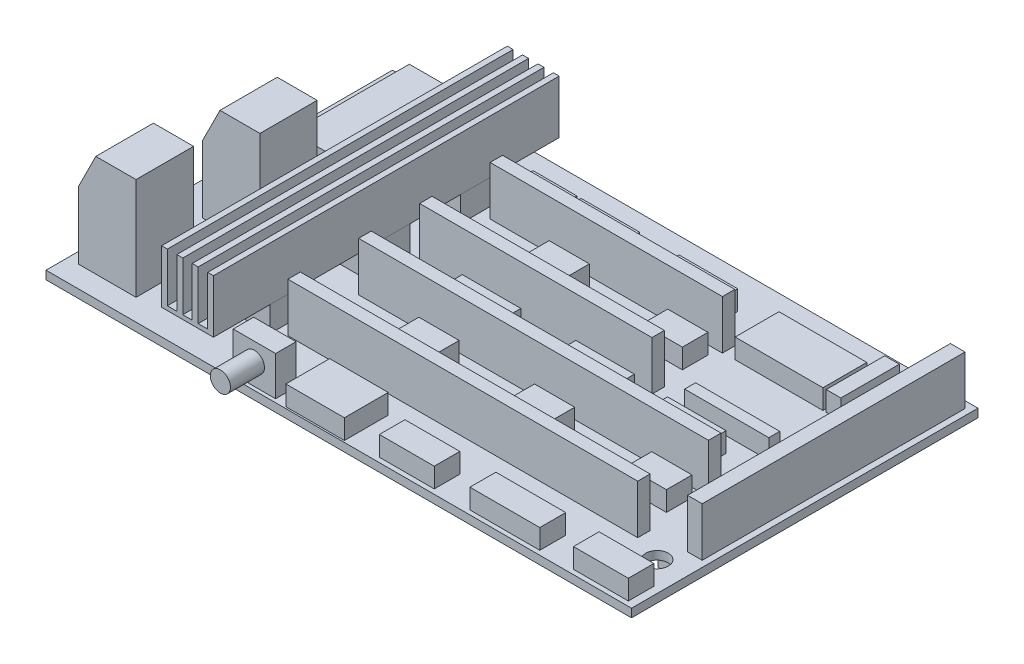
from build123d import *

# Parameters (mm, degrees)
SKETCH2_W              = 101.6076
SKETCH2_H              = 60.13
SKETCH2_R              = 1.95
BOSS_EXTRUDE1_DEPTH    = 1.45
SKETCH3_W              = 60.7104
SKETCH3_H              = 2.1564
BOSS_EXTRUDE2_DEPTH    = 8.5
SKETCH3_H_2            = 2.182
BOSS_EXTRUDE2_2_DEPTH  = 8.5
SKETCH3_W_2            = 40.3116
SKETCH3_H_3            = 2.1566
BOSS_EXTRUDE2_3_DEPTH  = 8.5
BOSS_EXTRUDE2_4_DEPTH  = 8.5
SKETCH3_W_3            = 2.5402
SKETCH3_H_4            = 45.6214
BOSS_EXTRUDE2_5_DEPTH  = 8.5
SKETCH4_W              = 10.1606
SKETCH4_H              = 7.6114
BOSS_EXTRUDE3_DEPTH    = 3.42
SKETCH4_W_2            = 9.5256
SKETCH4_H_2            = 4.4398
BOSS_EXTRUDE3_2_DEPTH  = 3.42
SKETCH4_W_3            = 12.1294
SKETCH4_H_3            = 4.5034
BOSS_EXTRUDE3_3_DEPTH  = 3.42
SKETCH4_W_4            = 9.5258
BOSS_EXTRUDE3_4_DEPTH  = 3.42
SKETCH4_W_5            = 6.9856
SKETCH4_H_4            = 4.44
BOSS_EXTRUDE3_5_DEPTH  = 3.42
SKETCH4_W_6            = 6.9854
BOSS_EXTRUDE3_6_DEPTH  = 3.42
BOSS_EXTRUDE3_7_DEPTH  = 3.42
BOSS_EXTRUDE3_8_DEPTH  = 3.42
BOSS_EXTRUDE3_9_DEPTH  = 3.42
SKETCH4_H_5            = 2.537
BOSS_EXTRUDE3_10_DEPTH = 3.42
SKETCH4_H_6            = 2.5372
BOSS_EXTRUDE3_11_DEPTH = 3.42
SKETCH4_H_7            = 5.0742
BOSS_EXTRUDE3_12_DEPTH = 3.42
SKETCH4_W_7            = 14.606
SKETCH4_H_8            = 1.9028
BOSS_EXTRUDE3_13_DEPTH = 3.42
SKETCH4_W_8            = 7.6204
BOSS_EXTRUDE3_14_DEPTH = 3.42
SKETCH4_W_9            = 10.1608
BOSS_EXTRUDE3_15_DEPTH = 3.42
BOSS_EXTRUDE3_16_DEPTH = 3.42
SKETCH4_W_10           = 15.241
BOSS_EXTRUDE3_17_DEPTH = 3.42
SKETCH4_W_11           = 2.5402
SKETCH4_H_9            = 10.1484
BOSS_EXTRUDE3_18_DEPTH = 3.42
SKETCH5_W              = 15.231
SKETCH5_H              = 2.5524
BOSS_EXTRUDE4_DEPTH    = 3.42
SKETCH5_W_2            = 20.3214
SKETCH5_H_2            = 2.5372
BOSS_EXTRUDE4_2_DEPTH  = 3.42
BOSS_EXTRUDE4_3_DEPTH  = 3.42
SKETCH5_W_3            = 5.0803
SKETCH5_H_3            = 45.6467
BOSS_EXTRUDE4_4_DEPTH  = 3.42
SKETCH5_W_4            = 20.3216
BOSS_EXTRUDE4_5_DEPTH  = 3.42
BOSS_EXTRUDE4_6_DEPTH  = 3.42
BOSS_EXTRUDE4_7_DEPTH  = 3.42
SKETCH6_W              = 8.381407694
SKETCH6_H              = 7.728310991
BOSS_EXTRUDE5_DEPTH    = 4.45
SKETCH6_H_2            = 7.72831099
BOSS_EXTRUDE5_2_DEPTH  = 4.45
BOSS_EXTRUDE5_3_DEPTH  = 4.45
SKETCH8_W              = 9
SKETCH8_H              = 60
BOSS_EXTRUDE6_DEPTH    = 9.25
SKETCH10_W             = 1.64
SKETCH10_H             = 8.522033602
CUT_EXTRUDE1_DEPTH     = 81.29992513
SKETCH11_W             = 7.8491
SKETCH11_H             = 20.3761
BOSS_EXTRUDE7_DEPTH    = 9.25
CHAMFER2_START         = -24
CHAMFER2_DEPTH         = 22
SKETCH12_W             = 9.9338
SKETCH12_H             = 9.938
BOSS_EXTRUDE8_DEPTH    = 17.7
SKETCH12_W_2           = 9.975
SKETCH12_H_2           = 9.9886
BOSS_EXTRUDE8_2_DEPTH  = 17.7
CHAMFER3_SIZE          = 6
CHAMFER3_SIZE2         = 3
CHAMFER4_SIZE          = 6
CHAMFER4_SIZE2         = 3
SKETCH13_W             = 7.3664
SKETCH13_H             = 3.552
BOSS_EXTRUDE9_DEPTH    = 6.8
SKETCH14_R             = 1.75
BOSS_EXTRUDE10_DEPTH   = 5.9


with BuildPart() as part:
    # Sketch2 → Boss-Extrude1 (new body)
    with BuildSketch(Plane(origin=(0, 0, 0), x_dir=(1, 0, 0), z_dir=(0, 1, 0))):
        with Locations((0.215202105, 0.322803158)):
            Rectangle(SKETCH2_W, SKETCH2_H)
        with Locations(Location((-35.347497895, 27.850703158, 0), (0, 0, 270))):
            Circle(SKETCH2_R, mode=Mode.SUBTRACT)
        with Locations(Location((45.938602105, -20.227996842, 0), (0, 0, 270))):
            Circle(SKETCH2_R, mode=Mode.SUBTRACT)
    extrude(amount=BOSS_EXTRUDE1_DEPTH)

    # Sketch11 → Boss-Extrude7 (add)
    with BuildSketch(Plane(origin=(0, 1.45, 0), x_dir=(1, 0, 0), z_dir=(0, 1, 0))):
        with Locations((-37.849447895, 13.303853158)):
            Rectangle(SKETCH11_W, SKETCH11_H)
    extrude(amount=BOSS_EXTRUDE7_DEPTH)

    # Chamfer2: read off the stored shape, not the designer's step
    # Chamfer2 outline → Chamfer2 (cut)
    with BuildSketch(Plane.XY.offset(CHAMFER2_START)):
        Polygon((-41.773997895, 7.7), (-40.773997895, 10.7), (-41.773997895, 10.7), align=None)
        Polygon((-34.924897895, 10.7), (-33.924897895, 7.7), (-33.924897895, 10.7), align=None)
    extrude(amount=CHAMFER2_DEPTH, mode=Mode.SUBTRACT)


with BuildPart() as body_2:
    # Sketch3 → Boss-Extrude2 (new body)
    with BuildSketch(Plane(origin=(0, 1.45, 0), x_dir=(1, 0, 0), z_dir=(0, 1, 0))):
        with Locations((10.606802105, -17.526896842)):
            Rectangle(SKETCH3_W, SKETCH3_H)
    extrude(amount=BOSS_EXTRUDE2_DEPTH)


with BuildPart() as body_3:
    # Sketch3 → Boss-Extrude2 2 (new body)
    with BuildSketch(Plane(origin=(0, 1.45, 0), x_dir=(1, 0, 0), z_dir=(0, 1, 0))):
        with Locations((10.606902105, -5.234496842)):
            Rectangle(SKETCH3_W, SKETCH3_H_2)
    extrude(amount=BOSS_EXTRUDE2_2_DEPTH)


with BuildPart() as body_4:
    # Sketch3 → Boss-Extrude2 3 (new body)
    with BuildSketch(Plane(origin=(0, 1.45, 0), x_dir=(1, 0, 0), z_dir=(0, 1, 0))):
        with Locations((0.459302105, 5.281903158)):
            Rectangle(SKETCH3_W_2, SKETCH3_H_3)
    extrude(amount=BOSS_EXTRUDE2_3_DEPTH)


with BuildPart() as body_5:
    # Sketch3 → Boss-Extrude2 4 (new body)
    with BuildSketch(Plane(origin=(0, 1.45, 0), x_dir=(1, 0, 0), z_dir=(0, 1, 0))):
        with Locations((0.407402105, 17.561603158)):
            Rectangle(SKETCH3_W_2, SKETCH3_H_3)
    extrude(amount=BOSS_EXTRUDE2_4_DEPTH)


with BuildPart() as body_6:
    # Sketch3 → Boss-Extrude2 5 (new body)
    with BuildSketch(Plane(origin=(0, 1.45, 0), x_dir=(1, 0, 0), z_dir=(0, 1, 0))):
        with Locations((48.682002105, 6.401203158)):
            Rectangle(SKETCH3_W_3, SKETCH3_H_4)
    extrude(amount=BOSS_EXTRUDE2_5_DEPTH)


with BuildPart() as body_7:
    # Sketch4 → Boss-Extrude3 (new body)
    with BuildSketch(Plane(origin=(0, 1.45, 0), x_dir=(1, 0, 0), z_dir=(0, 1, 0))):
        with Locations((-4.179297895, -25.644696842)):
            Rectangle(SKETCH4_W, SKETCH4_H)
    extrude(amount=BOSS_EXTRUDE3_DEPTH)


with BuildPart() as body_8:
    # Sketch4 → Boss-Extrude3 2 (new body)
    with BuildSketch(Plane(origin=(0, 1.45, 0), x_dir=(1, 0, 0), z_dir=(0, 1, 0))):
        with Locations((11.214302105, -26.710196842)):
            Rectangle(SKETCH4_W_2, SKETCH4_H_2)
    extrude(amount=BOSS_EXTRUDE3_2_DEPTH)


with BuildPart() as body_9:
    # Sketch4 → Boss-Extrude3 3 (new body)
    with BuildSketch(Plane(origin=(0, 1.45, 0), x_dir=(1, 0, 0), z_dir=(0, 1, 0))):
        with Locations((28.290602105, -26.741996842)):
            Rectangle(SKETCH4_W_3, SKETCH4_H_3)
    extrude(amount=BOSS_EXTRUDE3_3_DEPTH)


with BuildPart() as body_10:
    # Sketch4 → Boss-Extrude3 4 (new body)
    with BuildSketch(Plane(origin=(0, 1.45, 0), x_dir=(1, 0, 0), z_dir=(0, 1, 0))):
        with Locations((44.897102105, -26.710196842)):
            Rectangle(SKETCH4_W_4, SKETCH4_H_2)
    extrude(amount=BOSS_EXTRUDE3_4_DEPTH)


with BuildPart() as body_11:
    # Sketch4 → Boss-Extrude3 5 (new body)
    with BuildSketch(Plane(origin=(0, 1.45, 0), x_dir=(1, 0, 0), z_dir=(0, 1, 0))):
        with Locations((36.158802105, -10.097096842)):
            Rectangle(SKETCH4_W_5, SKETCH4_H_4)
    extrude(amount=BOSS_EXTRUDE3_5_DEPTH)


with BuildPart() as body_12:
    # Sketch4 → Boss-Extrude3 6 (new body)
    with BuildSketch(Plane(origin=(0, 1.45, 0), x_dir=(1, 0, 0), z_dir=(0, 1, 0))):
        with Locations((15.811902105, -10.097096842)):
            Rectangle(SKETCH4_W_6, SKETCH4_H_4)
    extrude(amount=BOSS_EXTRUDE3_6_DEPTH)


with BuildPart() as body_13:
    # Sketch4 → Boss-Extrude3 7 (new body)
    with BuildSketch(Plane(origin=(0, 1.45, 0), x_dir=(1, 0, 0), z_dir=(0, 1, 0))):
        with Locations((-4.255497895, -10.097096842)):
            Rectangle(SKETCH4_W_5, SKETCH4_H_4)
    extrude(amount=BOSS_EXTRUDE3_7_DEPTH)


with BuildPart() as body_14:
    # Sketch4 → Boss-Extrude3 8 (new body)
    with BuildSketch(Plane(origin=(0, 1.45, 0), x_dir=(1, 0, 0), z_dir=(0, 1, 0))):
        with Locations((-4.458697895, 12.711603158)):
            Rectangle(SKETCH4_W_5, SKETCH4_H_4)
    extrude(amount=BOSS_EXTRUDE3_8_DEPTH)


with BuildPart() as body_15:
    # Sketch4 → Boss-Extrude3 9 (new body)
    with BuildSketch(Plane(origin=(0, 1.45, 0), x_dir=(1, 0, 0), z_dir=(0, 1, 0))):
        with Locations((16.116702105, 12.711603158)):
            Rectangle(SKETCH4_W_6, SKETCH4_H_4)
    extrude(amount=BOSS_EXTRUDE3_9_DEPTH)


with BuildPart() as body_16:
    # Sketch4 → Boss-Extrude3 10 (new body)
    with BuildSketch(Plane(origin=(0, 1.45, 0), x_dir=(1, 0, 0), z_dir=(0, 1, 0))):
        with Locations((-5.296997895, 1.020503158)):
            Rectangle(SKETCH4_W, SKETCH4_H_5)
    extrude(amount=BOSS_EXTRUDE3_10_DEPTH)


with BuildPart() as body_17:
    # Sketch4 → Boss-Extrude3 11 (new body)
    with BuildSketch(Plane(origin=(0, 1.45, 0), x_dir=(1, 0, 0), z_dir=(0, 1, 0))):
        with Locations((14.440202105, 0.995203158)):
            Rectangle(SKETCH4_W, SKETCH4_H_6)
    extrude(amount=BOSS_EXTRUDE3_11_DEPTH)


with BuildPart() as body_18:
    # Sketch4 → Boss-Extrude3 12 (new body)
    with BuildSketch(Plane(origin=(0, 1.45, 0), x_dir=(1, 0, 0), z_dir=(0, 1, 0))):
        with Locations((30.875302105, -0.806196842)):
            Rectangle(SKETCH4_W, SKETCH4_H_7)
    extrude(amount=BOSS_EXTRUDE3_12_DEPTH)


with BuildPart() as body_19:
    # Sketch4 → Boss-Extrude3 13 (new body)
    with BuildSketch(Plane(origin=(0, 1.45, 0), x_dir=(1, 0, 0), z_dir=(0, 1, 0))):
        with Locations((33.415402105, 5.333703158)):
            Rectangle(SKETCH4_W_7, SKETCH4_H_8)
    extrude(amount=BOSS_EXTRUDE3_13_DEPTH)


with BuildPart() as body_20:
    # Sketch4 → Boss-Extrude3 14 (new body)
    with BuildSketch(Plane(origin=(0, 1.45, 0), x_dir=(1, 0, 0), z_dir=(0, 1, 0))):
        with Locations((-16.054797895, 22.789103158)):
            Rectangle(SKETCH4_W_8, SKETCH4_H_6)
    extrude(amount=BOSS_EXTRUDE3_14_DEPTH)


with BuildPart() as body_21:
    # Sketch4 → Boss-Extrude3 15 (new body)
    with BuildSketch(Plane(origin=(0, 1.45, 0), x_dir=(1, 0, 0), z_dir=(0, 1, 0))):
        with Locations((-6.440097895, 22.789103158)):
            Rectangle(SKETCH4_W_9, SKETCH4_H_6)
    extrude(amount=BOSS_EXTRUDE3_15_DEPTH)


with BuildPart() as body_22:
    # Sketch4 → Boss-Extrude3 16 (new body)
    with BuildSketch(Plane(origin=(0, 1.45, 0), x_dir=(1, 0, 0), z_dir=(0, 1, 0))):
        with Locations((10.553702105, 22.789103158)):
            Rectangle(SKETCH4_W, SKETCH4_H_6)
    extrude(amount=BOSS_EXTRUDE3_16_DEPTH)


with BuildPart() as body_23:
    # Sketch4 → Boss-Extrude3 17 (new body)
    with BuildSketch(Plane(origin=(0, 1.45, 0), x_dir=(1, 0, 0), z_dir=(0, 1, 0))):
        with Locations((30.291002105, 20.391603158)):
            Rectangle(SKETCH4_W_10, SKETCH4_H)
    extrude(amount=BOSS_EXTRUDE3_17_DEPTH)


with BuildPart() as body_24:
    # Sketch4 → Boss-Extrude3 18 (new body)
    with BuildSketch(Plane(origin=(0, 1.45, 0), x_dir=(1, 0, 0), z_dir=(0, 1, 0))):
        with Locations((39.740502105, 21.672803158)):
            Rectangle(SKETCH4_W_11, SKETCH4_H_9)
    extrude(amount=BOSS_EXTRUDE3_18_DEPTH)


with BuildPart() as body_25:
    # Sketch5 → Boss-Extrude4 (new body)
    with BuildSketch(Plane.XZ):
        with Locations((-11.004797895, 20.278696842)):
            Rectangle(SKETCH5_W, SKETCH5_H)
    extrude(amount=BOSS_EXTRUDE4_DEPTH)


with BuildPart() as body_26:
    # Sketch5 → Boss-Extrude4 2 (new body)
    with BuildSketch(Plane.XZ):
        with Locations((9.283702105, 20.265996842)):
            Rectangle(SKETCH5_W_2, SKETCH5_H_2)
    extrude(amount=BOSS_EXTRUDE4_2_DEPTH)


with BuildPart() as body_27:
    # Sketch5 → Boss-Extrude4 3 (new body)
    with BuildSketch(Plane.XZ):
        with Locations((32.145402105, 20.265996842)):
            Rectangle(SKETCH5_W_2, SKETCH5_H_2)
    extrude(amount=BOSS_EXTRUDE4_3_DEPTH)


with BuildPart() as body_28:
    # Sketch5 → Boss-Extrude4 4 (new body)
    with BuildSketch(Plane.XZ):
        with Locations((44.871752105, -6.388553158)):
            Rectangle(SKETCH5_W_3, SKETCH5_H_3)
    extrude(amount=BOSS_EXTRUDE4_4_DEPTH)


with BuildPart() as body_29:
    # Sketch5 → Boss-Extrude4 5 (new body)
    with BuildSketch(Plane.XZ):
        with Locations((-17.616897895, -27.939503158)):
            Rectangle(SKETCH5_W_4, SKETCH5_H_2)
    extrude(amount=BOSS_EXTRUDE4_5_DEPTH)


with BuildPart() as body_30:
    # Sketch5 → Boss-Extrude4 6 (new body)
    with BuildSketch(Plane.XZ):
        with Locations((4.228702105, -27.939503158)):
            Rectangle(SKETCH5_W_4, SKETCH5_H_2)
    extrude(amount=BOSS_EXTRUDE4_6_DEPTH)


with BuildPart() as body_31:
    # Sketch5 → Boss-Extrude4 7 (new body)
    with BuildSketch(Plane.XZ):
        with Locations((27.090302105, -27.939503158)):
            Rectangle(SKETCH5_W_2, SKETCH5_H_2)
    extrude(amount=BOSS_EXTRUDE4_7_DEPTH)


with BuildPart() as body_32:
    # Sketch6 → Boss-Extrude5 (new body)
    with BuildSketch(Plane(origin=(0, 1.45, 0), x_dir=(1, 0, 0), z_dir=(0, 1, 0))):
        with Locations((-25.799816581, 17.085618546)):
            Rectangle(SKETCH6_W, SKETCH6_H)
    extrude(amount=BOSS_EXTRUDE5_DEPTH)


with BuildPart() as body_33:
    # Sketch6 → Boss-Extrude5 2 (new body)
    with BuildSketch(Plane(origin=(0, 1.45, 0), x_dir=(1, 0, 0), z_dir=(0, 1, 0))):
        with Locations((-25.799816581, 0.540502059)):
            Rectangle(SKETCH6_W, SKETCH6_H_2)
    extrude(amount=BOSS_EXTRUDE5_2_DEPTH)


with BuildPart() as body_34:
    # Sketch6 → Boss-Extrude5 3 (new body)
    with BuildSketch(Plane(origin=(0, 1.45, 0), x_dir=(1, 0, 0), z_dir=(0, 1, 0))):
        with Locations((-25.799816581, -16.004614428)):
            Rectangle(SKETCH6_W, SKETCH6_H)
    extrude(amount=BOSS_EXTRUDE5_3_DEPTH)


with BuildPart() as body_35:
    # Sketch8 → Boss-Extrude6 (new body)
    with BuildSketch(Plane(origin=(0, 5.9, 0), x_dir=(1, 0, 0), z_dir=(0, 1, 0))):
        with Locations((-26.030074461, 0.257803158)):
            Rectangle(SKETCH8_W, SKETCH8_H)
    extrude(amount=BOSS_EXTRUDE6_DEPTH)

    # Sketch10 → Cut-Extrude1 (cut, through all)
    with BuildSketch(Plane.XY.offset(29.742196842)):
        with Locations((-26.030074461, 10.888983199)):
            Rectangle(SKETCH10_W, SKETCH10_H)
        with Locations((-28.710074461, 10.888983199)):
            Rectangle(SKETCH10_W, SKETCH10_H)
        with Locations((-23.350074461, 10.888983199)):
            Rectangle(SKETCH10_W, SKETCH10_H)
    extrude(amount=-CUT_EXTRUDE1_DEPTH, mode=Mode.SUBTRACT)


with BuildPart() as body_36:
    # Sketch12 → Boss-Extrude8 (new body)
    with BuildSketch(Plane(origin=(0, 1.45, 0), x_dir=(1, 0, 0), z_dir=(0, 1, 0))):
        with Locations((-39.849897895, -3.355796842)):
            Rectangle(SKETCH12_W, SKETCH12_H)
    extrude(amount=BOSS_EXTRUDE8_DEPTH)

    # Chamfer3
    chamfer3_edges = [body_36.edges().sort_by_distance(p)[0] for p in [
        (-44.816797895, 19.15, 3.355796842),
    ]]
    chamfer3_side = [body_36.faces().sort_by_distance(p)[0] for p in [
        (-44.816797895, 10.3, 3.355796842),
    ]]
    chamfer(chamfer3_edges, length=CHAMFER3_SIZE, length2=CHAMFER3_SIZE2, reference=chamfer3_side[0])


with BuildPart() as body_37:
    # Sketch12 → Boss-Extrude8 2 (new body)
    with BuildSketch(Plane(origin=(0, 1.45, 0), x_dir=(1, 0, 0), z_dir=(0, 1, 0))):
        with Locations((-43.681497895, -21.018496842)):
            Rectangle(SKETCH12_W_2, SKETCH12_H_2)
    extrude(amount=BOSS_EXTRUDE8_2_DEPTH)

    # Chamfer4
    chamfer4_edges = [body_37.edges().sort_by_distance(p)[0] for p in [
        (-48.668997895, 19.15, 21.018496842),
    ]]
    chamfer4_side = [body_37.faces().sort_by_distance(p)[0] for p in [
        (-48.668997895, 10.3, 21.018496842),
    ]]
    chamfer(chamfer4_edges, length=CHAMFER4_SIZE, length2=CHAMFER4_SIZE2, reference=chamfer4_side[0])


with BuildPart() as body_38:
    # Sketch13 → Boss-Extrude9 (new body)
    with BuildSketch(Plane(origin=(0, 1.45, 0), x_dir=(1, 0, 0), z_dir=(0, 1, 0))):
        with Locations((-15.025997895, -27.367396842)):
            Rectangle(SKETCH13_W, SKETCH13_H)
    extrude(amount=BOSS_EXTRUDE9_DEPTH)


with BuildPart() as body_39:
    # Sketch14 → Boss-Extrude10 (new body)
    with BuildSketch(Plane.XY.offset(29.143396842)):
        with Locations((-15.025997895, 5.153130887)):
            Circle(SKETCH14_R)
    extrude(amount=BOSS_EXTRUDE10_DEPTH)


solid = Compound([part.part, body_2.part, body_3.part, body_4.part, body_5.part, body_6.part, body_7.part, body_8.part, body_9.part, body_10.part, body_11.part, body_12.part, body_13.part, body_14.part, body_15.part, body_16.part, body_17.part, body_18.part, body_19.part, body_20.part, body_21.part, body_22.part, body_23.part, body_24.part, body_25.part, body_26.part, body_27.part, body_28.part, body_29.part, body_30.part, body_31.part, body_32.part, body_33.part, body_34.part, body_35.part, body_36.part, body_37.part, body_38.part, body_39.part])
